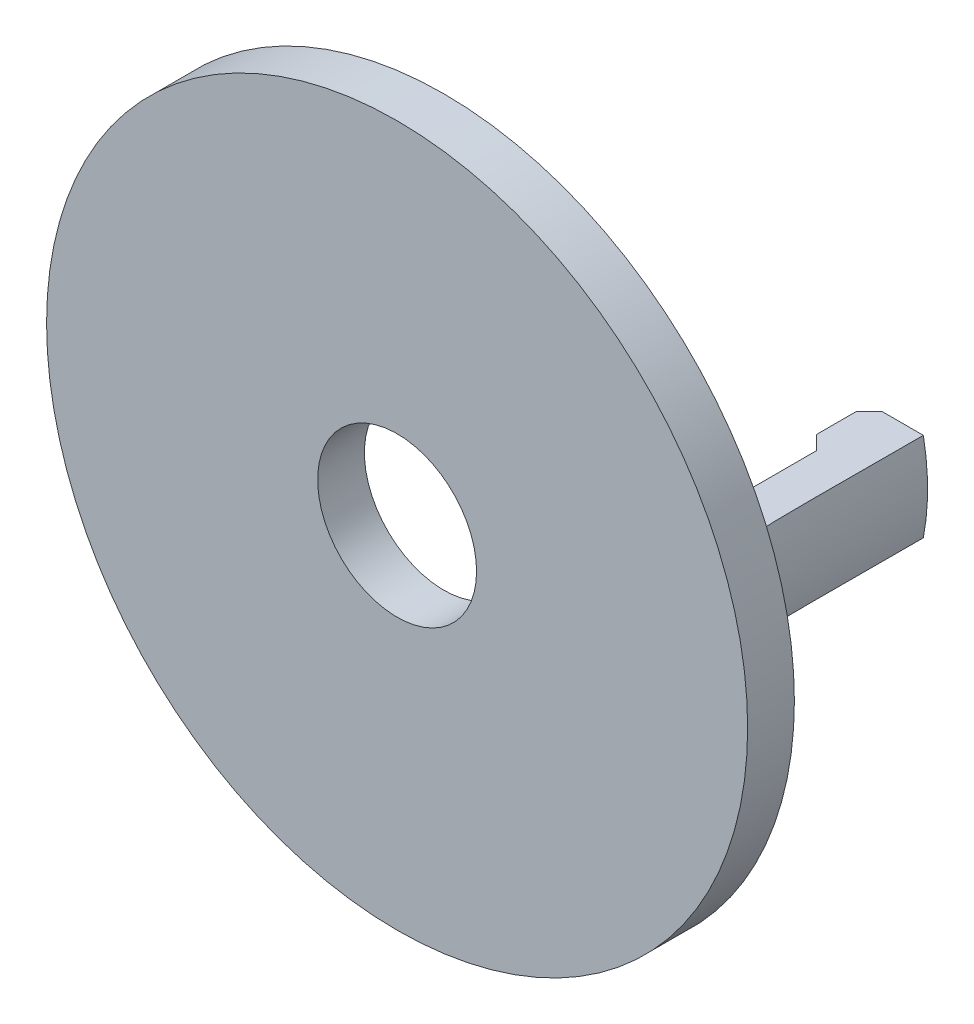
from build123d import *

# Parameters (mm, degrees)
SKETCH4_R           = 37.5
BOSS_EXTRUDE2_DEPTH = 5
SKETCH5_R           = 8.5
CUT_EXTRUDE1_DEPTH  = 54.268189382
BOSS_EXTRUDE3_DEPTH = 4.75
SKETCH1_R           = 37.5
CUT_EXTRUDE2_DEPTH  = 60.397495738


with BuildPart() as part:
    # Sketch4 → Boss-Extrude2 (new body)
    with BuildSketch(Plane.XY):
        Circle(SKETCH4_R)
    extrude(amount=BOSS_EXTRUDE2_DEPTH)

    # Sketch5 → Cut-Extrude1 (cut, through all)
    with BuildSketch(Plane.XY.offset(5)):
        Circle(SKETCH5_R)
    extrude(amount=-CUT_EXTRUDE1_DEPTH, mode=Mode.SUBTRACT)

    # Sketch6 → Boss-Extrude3 (add, symmetric)
    with BuildSketch(Plane(origin=(0, 0, 0), x_dir=(1, 0, 0), z_dir=(0, 1, 0))):
        Polygon((20.25, 2.896446609), (17.353553391, 0), (26.5, 0), (26.5, 26.75), (20.103553391, 26.75), (18.75, 25.396446609), (18.75, 21.103553391), (20.25, 19.603553391), align=None)
    boss_extrude3 = extrude(amount=BOSS_EXTRUDE3_DEPTH, both=True)

    # Sketch1 → Cut-Extrude2 (cut, through all)
    with BuildSketch(Plane.XY):
        Circle(SKETCH1_R)
        with BuildLine():
            ThreePointArc((-1, 26.481125354), (18.381376445, 19.088609169), (26.5, 0))
            ThreePointArc((26.5, 0), (18.381376445, -19.088609169), (-1, -26.481125354))
            ThreePointArc((-1, -26.481125354), (-28.5, 0), (-1, 26.481125354))
        make_face(mode=Mode.SUBTRACT)
    cut_extrude2 = extrude(amount=-CUT_EXTRUDE2_DEPTH, mode=Mode.SUBTRACT)

    # Sketch6<4> → Cut-Revolve1 (revolve, cut)
    with BuildSketch(Plane(origin=(0, 0, 0), x_dir=(1, 0, 0), z_dir=(0, 1, 0))):
        with BuildLine():
            add(Edge.make_bspline(
                [(25, 26.75), (25, 22.72818992), (24.990050178, 20.542467854), (25.01194908, 14.942357728), (24.774871471, 4.983935506), (26.5, 0)],
                knots=[0, 0, 0, 0, 0.44660472, 0.54660472, 1, 1, 1, 1], degree=3))
            Line((26.5, 0), (26.5, 26.75))
            Line((26.5, 26.75), (25, 26.75))
        make_face()
    cut_revolve1 = revolve(axis=Axis((0, 0, 0), (0, 0, -1)), mode=Mode.SUBTRACT)

    # Mirror1: Boss-Extrude3, Cut-Extrude2, Cut-Revolve1 across plane
    add(boss_extrude3.mirror(Plane(origin=(0, 0, 0), x_dir=(0, 0, 1), z_dir=(1, 0, 0))))
    add(cut_extrude2.mirror(Plane(origin=(0, 0, 0), x_dir=(0, 0, 1), z_dir=(1, 0, 0))), mode=Mode.SUBTRACT)
    add(cut_revolve1.mirror(Plane(origin=(0, 0, 0), x_dir=(0, 0, 1), z_dir=(1, 0, 0))), mode=Mode.SUBTRACT)


solid = part.part
